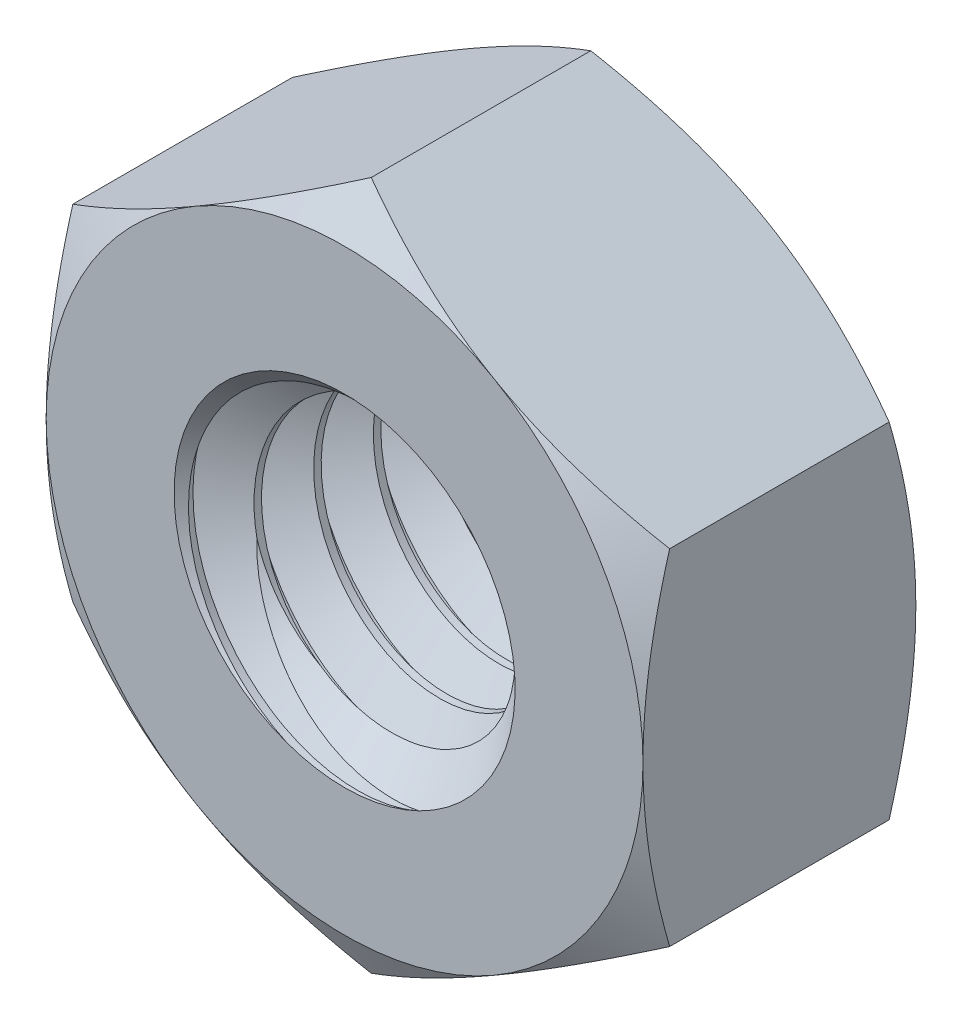
from build123d import *

# Parameters (mm, degrees)
EXTRUDE1_DEPTH          = 1.6
SKETCH13_R              = 2
BOSS_EXTRUDE1_DEPTH     = 3.2
CUT_SWEEP1_PITCH        = 0.7
SKETCH7_OUTSIDE_W       = 99.22
SKETCH7_OUTSIDE_H       = 100.302
SKETCH7_OUTSIDE_R       = 3.5
EXTRUDE2_DEPTH          = 25.4
EXTRUDE2_DRAFT          = -60
MIRROR2_COPY_1_SKETCH_W = 99.22
MIRROR2_COPY_1_SKETCH_H = 100.302
MIRROR2_COPY_1_SKETCH_R = 3.5
MIRROR2_COPY_1_DEPTH    = 25.4
MIRROR2_COPY_1_DRAFT    = -60


with BuildPart() as part:
    # Sketch1 → Extrude1 (new, symmetric)
    with BuildSketch(Plane.XY):
        Polygon((-3.5, 2.020725942), (-3.5, -2.020725942), (0, -4.041451884), (3.5, -2.020725942), (3.5, 2.020725942), (0, 4.041451884), align=None)
    extrude(amount=EXTRUDE1_DEPTH, both=True)

    # Cut-Extrude2 cone 1 section (through the dimple's axis) → Cut-Extrude2 (revolve, cut)
    with BuildSketch(Plane(origin=(0, 0, 1.6), x_dir=(0, -1, 0), z_dir=(1, 0, 0))):
        Polygon((0, 0), (2, 0), (0, 2), align=None)
    revolve(axis=Axis((0, 0, 1.6), (0, 0, -1)), mode=Mode.SUBTRACT)

    # Cut-Extrude3 cone 1 section (through the dimple's axis) → Cut-Extrude3 (revolve, cut)
    with BuildSketch(Plane(origin=(0, 0, -1.6), x_dir=(0, 1, 0), z_dir=(1, 0, 0))):
        Polygon((0, 0), (2, 0), (0, 2), align=None)
    revolve(axis=Axis((0, 0, -1.6), (0, 0, 1)), mode=Mode.SUBTRACT)


with BuildPart() as body_2:
    # Sketch13 → Boss-Extrude1 (new body)
    with BuildSketch(Plane(origin=(0, 0, -1.6), x_dir=(-1, 0, 0), z_dir=(0, 0, -1))):
        Circle(SKETCH13_R)
    extrude(amount=-BOSS_EXTRUDE1_DEPTH)

    # Cut-Sweep1: arcs per turn and ends read off the stored shape
    # Cut-Sweep1: the profile of Sketch12 profile screwed along a right-hand helix through 6.666667 turns, 6 arcs to a turn; built about Z, then put on its axis
    cut_sweep1_z = Axis((0, 0, 0), (0, 0, 1))
    cut_sweep1_corners = [(2.0003, 0, -1.312673205), (2.0003, 0, -0.699826795), (1.545336663, 0, -0.9625), (1.545336663, 0, -1.05)]
    with BuildLine(mode=Mode.PRIVATE) as cut_sweep1_profile:
        Line(cut_sweep1_corners[0], cut_sweep1_corners[1])
        Line(cut_sweep1_corners[1], cut_sweep1_corners[2])
        Line(cut_sweep1_corners[2], cut_sweep1_corners[3])
        Line(cut_sweep1_corners[3], cut_sweep1_corners[0])
    cut_sweep1_cap = Face(cut_sweep1_profile.wire())
    cut_sweep1_turn_angles = [0, 30, 60, 90, 120, 150, 180, 210, 240, 270, 300, 330, 360]
    cut_sweep1_turn_weights = [1, 0.8660254037844387, 1, 0.8660254037844387, 1, 0.8660254037844387, 1, 0.8660254037844387, 1, 0.8660254037844387, 1, 0.8660254037844387, 1]
    cut_sweep1_turn_rails = [Edge.make_bspline([Vector(p[0], p[1], 0).rotate(cut_sweep1_z, cut_sweep1_turn_angles[k]) / cut_sweep1_turn_weights[k] + Vector(0, 0, p[2] + CUT_SWEEP1_PITCH * cut_sweep1_turn_angles[k] / 360) for k in range(13)], [0, 0, 0, 1, 1, 2, 2, 3, 3, 4, 4, 5, 5, 6, 6, 6], 2, cut_sweep1_turn_weights) for p in cut_sweep1_corners]
    cut_sweep1_turn_sides = [Face.make_surface_from_curves(cut_sweep1_turn_rails[p[0]], cut_sweep1_turn_rails[p[1]]) for p in [(0, 1), (1, 2), (2, 3), (3, 0)]]
    cut_sweep1_last_angles = [2160, 2190, 2220, 2250, 2280, 2310, 2340, 2370, 2400]
    cut_sweep1_last_weights = [1, 0.8660254037844387, 1, 0.8660254037844387, 1, 0.8660254037844387, 1, 0.8660254037844387, 1]
    cut_sweep1_last_rails = [Edge.make_bspline([Vector(p[0], p[1], 0).rotate(cut_sweep1_z, cut_sweep1_last_angles[k]) / cut_sweep1_last_weights[k] + Vector(0, 0, p[2] + CUT_SWEEP1_PITCH * cut_sweep1_last_angles[k] / 360) for k in range(9)], [0, 0, 0, 1, 1, 2, 2, 3, 3, 4, 4, 4], 2, cut_sweep1_last_weights) for p in cut_sweep1_corners]
    cut_sweep1_last_sides = [Face.make_surface_from_curves(cut_sweep1_last_rails[p[0]], cut_sweep1_last_rails[p[1]]) for p in [(0, 1), (1, 2), (2, 3), (3, 0)]]
    cut_sweep1 = Plane(origin=(0, 0, -1.6), x_dir=(0, 1, 0), z_dir=(0, 0, 1)) * Solid(Shell([*[p.moved(Location((0, 0, CUT_SWEEP1_PITCH * i))) for i in range(6) for p in cut_sweep1_turn_sides], *cut_sweep1_last_sides, cut_sweep1_cap, cut_sweep1_cap.rotate(cut_sweep1_z, 2400).moved(Location((0, 0, CUT_SWEEP1_PITCH * 2400 / 360)))]))
    add(cut_sweep1, mode=Mode.SUBTRACT)


with BuildPart() as part_1:
    add(part.part)

    # Combine1: cut body 2
    add(body_2.part, mode=Mode.SUBTRACT)


with BuildPart() as extrude2_tool:
    # Sketch7 outside → Extrude2 (with draft: the straight prism first)
    with BuildSketch(Plane.XY.offset(1.6)):
        Rectangle(SKETCH7_OUTSIDE_W, SKETCH7_OUTSIDE_H)
        Circle(SKETCH7_OUTSIDE_R, mode=Mode.SUBTRACT)
    extrude(amount=-EXTRUDE2_DEPTH)
    # Extrude2: the draft: its side faces are tilted about the plane it starts from
    extrude2_sides = [extrude2_tool.faces().sort_by_distance(p)[0] for p in [
        (0, -50.151, -11.1),
        (49.61, 0, -11.1),
        (0, 50.151, -11.1),
        (-49.61, 0, -11.1),
        (-3.5, 0, -11.1),
    ]]
    draft(extrude2_sides, Plane.XY.offset(1.6), EXTRUDE2_DRAFT)


with BuildPart() as part_2:
    add(part_1.part)

    # Extrude2: cut by extrude2_tool
    add(extrude2_tool.part, mode=Mode.SUBTRACT)


with BuildPart() as mirror2_copy_1_tool:
    # Mirror2 copy 1 sketch → Mirror2 copy 1 (with draft: the straight prism first)
    with BuildSketch(Plane(origin=(0, 0, -1.6), x_dir=(1, 0, 0), z_dir=(0, 0, -1))):
        Rectangle(MIRROR2_COPY_1_SKETCH_W, MIRROR2_COPY_1_SKETCH_H)
        Circle(MIRROR2_COPY_1_SKETCH_R, mode=Mode.SUBTRACT)
    extrude(amount=-MIRROR2_COPY_1_DEPTH)
    # Mirror2 copy 1: the draft: its side faces are tilted about the plane it starts from
    mirror2_copy_1_sides = [mirror2_copy_1_tool.faces().sort_by_distance(p)[0] for p in [
        (0, -50.151, 11.1),
        (49.61, 0, 11.1),
        (0, 50.151, 11.1),
        (-49.61, 0, 11.1),
        (-3.5, 0, 11.1),
    ]]
    draft(mirror2_copy_1_sides, Plane(origin=(0, 0, -1.6), x_dir=(1, 0, 0), z_dir=(0, 0, -1)), MIRROR2_COPY_1_DRAFT)


with BuildPart() as part_3:
    add(part_2.part)

    # Mirror2 copy 1: cut by mirror2_copy_1_tool
    add(mirror2_copy_1_tool.part, mode=Mode.SUBTRACT)


solid = part_3.part
